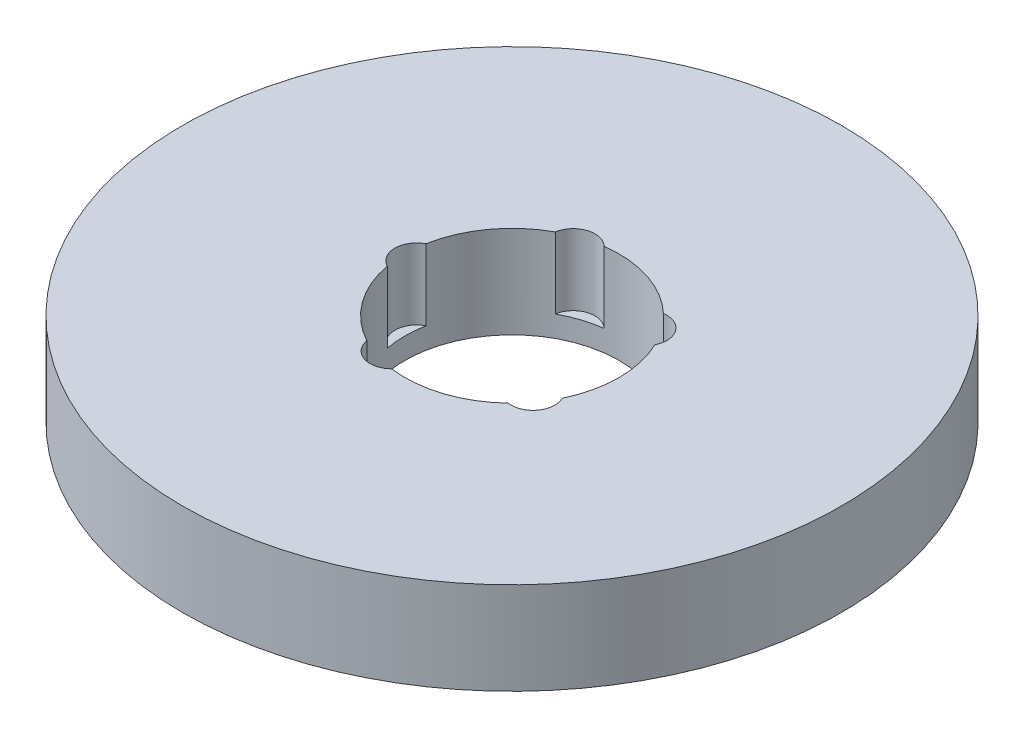
from build123d import *

# Parameters (mm, degrees)
SKETCH1_R           = 100
BOSS_EXTRUDE1_DEPTH = 28
SKETCH2_R           = 32.5
CUT_EXTRUDE1_DEPTH  = 145.166570328
SKETCH3_R           = 6.615606699
CUT_EXTRUDE2_DEPTH  = 21.563167694
CIRPATTERN1_COUNT   = 5


with BuildPart() as part:
    # Sketch1 → Boss-Extrude1 (new body)
    with BuildSketch(Plane(origin=(0, 0, 0), x_dir=(1, 0, 0), z_dir=(0, 1, 0))):
        Circle(SKETCH1_R)
    extrude(amount=BOSS_EXTRUDE1_DEPTH)

    # Sketch2 → Cut-Extrude1 (cut, through all)
    with BuildSketch(Plane(origin=(0, 0, 0), x_dir=(1, 0, 0), z_dir=(0, 1, 0))):
        Circle(SKETCH2_R)
    extrude(amount=CUT_EXTRUDE1_DEPTH, mode=Mode.SUBTRACT)

    # Sketch3 → Cut-Extrude2 (cut)
    with BuildSketch(Plane(origin=(0, 28, 0), x_dir=(1, 0, 0), z_dir=(0, 1, 0))):
        with Locations((-28.913452943, 0)):
            Circle(SKETCH3_R)
    cut_extrude2 = extrude(amount=-CUT_EXTRUDE2_DEPTH, mode=Mode.SUBTRACT)

    # CirPattern1: Cut-Extrude2 ×5 about axis
    cirpattern1_axis = Axis((0, 0, 0), (0, 1, 0))
    for i in range(1, CIRPATTERN1_COUNT):
        add(cut_extrude2.rotate(cirpattern1_axis, i * 360 / CIRPATTERN1_COUNT), mode=Mode.SUBTRACT)


solid = part.part
